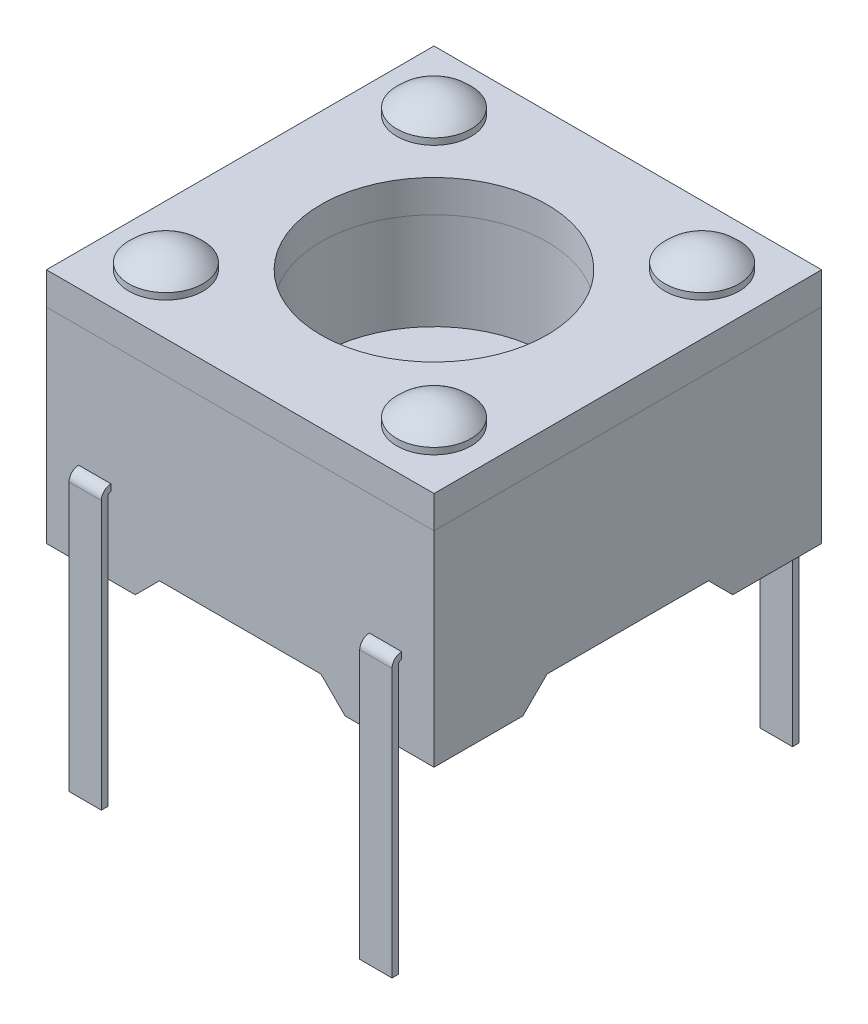
from build123d import *

# Parameters (mm, degrees)
SKETCH1_W                                = 6
SKETCH1_H                                = 6
BOSS_EXTRUDE1_DEPTH                      = 3.17
SKETCH2_W                                = 6
SKETCH2_H                                = 6
BOSS_EXTRUDE2_DEPTH                      = 0.5
SKETCH5_R                                = 1.75
CUT_EXTRUDE1_DEPTH                       = 2
EXTRUDE_THIN1_DEPTH                      = 0.5
MIRROR1_AT_THE_SECOND_PLANE_COPY_1_DEPTH = 0.5
CUT_EXTRUDE4_DEPTH                       = 8.879270271
CIRPATTERN1_COUNT                        = 2
CIRPATTERN1_ANGLE                        = 90


# Read off the part's stored shape, not the designer's step: Sketch-Pattern1
with BuildPart() as part:
    # Sketch1 → Boss-Extrude1 (new body)
    with BuildSketch(Plane(origin=(0, 0, 0), x_dir=(1, 0, 0), z_dir=(0, 1, 0))):
        Rectangle(SKETCH1_W, SKETCH1_H)
    extrude(amount=BOSS_EXTRUDE1_DEPTH)


with BuildPart() as body_2:
    # Sketch2 → Boss-Extrude2 (new body)
    with BuildSketch(Plane(origin=(0, 3.17, 0), x_dir=(1, 0, 0), z_dir=(0, 1, 0))):
        Rectangle(SKETCH2_W, SKETCH2_H)
    extrude(amount=BOSS_EXTRUDE2_DEPTH)

    # Sketch4 → Revolve1 (revolve)
    with BuildSketch(Plane.YZ.offset(2.075), mode=Mode.PRIVATE) as revolve1_sk:
        with BuildLine():
            Line((3.67, 2.65), (3.77, 2.65))
            ThreePointArc((3.77, 2.65), (3.954796332, 2.388498405), (4.02, 2.075))
            Line((4.02, 2.075), (3.67, 2.075))
            Line((3.67, 2.075), (3.17, 2.075))
            Line((3.17, 2.075), (3.17, 2.65))
            Line((3.17, 2.65), (3.67, 2.65))
        make_face()
    revolve(revolve1_sk.sketch.rotate(Axis((2.075, 3.67, 2.075), (0, 1, 0)), 180), axis=Axis((2.075, 3.67, 2.075), (0, 1, 0)))

    # Sketch-Pattern1 outline → Sketch-Pattern1 (revolve)
    with BuildSketch(Plane(origin=(-2.075, 0, 2.075), x_dir=(1, 0, 0), z_dir=(0, 0, 1))):
        with BuildLine():
            Line((0.575, 3.67), (0.575000001, 3.769999999))
            ThreePointArc((0.575000001, 3.769999999), (0.313498406, 3.954796332), (0, 4.02))
            Line((0, 4.02), (0, 3.67))
            Line((0, 3.67), (0.575, 3.67))
        make_face()
    revolve(axis=Axis((-2.075, 0, 2.075), (0, 1, 0)))

    # Sketch-Pattern1 2 outline → Sketch-Pattern1 2 (revolve)
    with BuildSketch(Plane(origin=(-2.075, 0, -2.075), x_dir=(1, 0, 0), z_dir=(0, 0, 1))):
        with BuildLine():
            Line((0.575, 3.67), (0.575000001, 3.769999999))
            ThreePointArc((0.575000001, 3.769999999), (0.313498406, 3.954796332), (0, 4.02))
            Line((0, 4.02), (0, 3.67))
            Line((0, 3.67), (0.575, 3.67))
        make_face()
    revolve(axis=Axis((-2.075, 0, -2.075), (0, 1, 0)))

    # Sketch-Pattern1 3 outline → Sketch-Pattern1 3 (revolve)
    with BuildSketch(Plane(origin=(2.075, 0, -2.075), x_dir=(1, 0, 0), z_dir=(0, 0, 1))):
        with BuildLine():
            Line((0.575, 3.67), (0.575000001, 3.769999999))
            ThreePointArc((0.575000001, 3.769999999), (0.313498406, 3.954796332), (0, 4.02))
            Line((0, 4.02), (0, 3.67))
            Line((0, 3.67), (0.575, 3.67))
        make_face()
    revolve(axis=Axis((2.075, 0, -2.075), (0, 1, 0)))


with BuildPart() as cut_extrude1_tool:
    # Sketch5 → Cut-Extrude1 (new body)
    with BuildSketch(Plane(origin=(0, 3.67, 0), x_dir=(1, 0, 0), z_dir=(0, 1, 0))):
        with Locations(Location((0, 0, 0), (0, 0, 270))):
            Circle(SKETCH5_R)
    extrude(amount=-CUT_EXTRUDE1_DEPTH)


with BuildPart() as part_1:
    add(part.part)

    # Cut-Extrude1: cut by cut_extrude1_tool
    add(cut_extrude1_tool.part, mode=Mode.SUBTRACT)

    # Sketch6 → Extrude-Thin1 (add)
    with BuildSketch(Plane.ZY.offset(2.5)):
        with BuildLine():
            ThreePointArc((3, 1.2), (3.035355348, 1.185355337), (3.05, 1.149999984))
            Line((3.05, 1.149999984), (3.05, -3))
            Line((3.05, -3), (3.15, -3))
            Line((3.15, -3), (3.15, 1.150000012))
            ThreePointArc((3.15, 1.150000012), (3.106066008, 1.256066033), (2.999999977, 1.3))
            Line((2.999999977, 1.3), (3, 1.2))
        make_face()
    extrude_thin1 = extrude(amount=-EXTRUDE_THIN1_DEPTH)

    # Mirror1: Extrude-Thin1 across plane
    add(extrude_thin1.mirror(Plane.XY))

    # Mirror1 at the second plane: Extrude-Thin1 across plane
    add(extrude_thin1.mirror(Plane(origin=(0, 0, 0), x_dir=(0, 0, 1), z_dir=(1, 0, 0))))

    # Mirror1 at the second plane copy 1 sketc → Mirror1 at the second plane copy 1 (add)
    with BuildSketch(Plane(origin=(2.5, 0, 0), x_dir=(0, 0, -1), z_dir=(1, 0, 0))):
        with BuildLine():
            ThreePointArc((3, 1.2), (3.035355348, 1.185355337), (3.05, 1.149999984))
            Line((3.05, 1.149999984), (3.05, -3))
            Line((3.05, -3), (3.15, -3))
            Line((3.15, -3), (3.15, 1.150000012))
            ThreePointArc((3.15, 1.150000012), (3.106066008, 1.256066033), (2.999999977, 1.3))
            Line((2.999999977, 1.3), (3, 1.2))
        make_face()
    extrude(amount=-MIRROR1_AT_THE_SECOND_PLANE_COPY_1_DEPTH)

    # Sketch7 → Cut-Extrude4 (cut, through all)
    with BuildSketch(Plane.ZY.offset(3)):
        Polygon((-1.625, 0), (-1.25, 0.375), (1.25, 0.375), (1.625, 0), align=None)
    cut_extrude4 = extrude(amount=-CUT_EXTRUDE4_DEPTH, mode=Mode.SUBTRACT)

    # CirPattern1: Cut-Extrude4 ×2 about axis
    cirpattern1_axis = Axis((0, 4.371, 0), (0, -1, 0))
    for i in range(1, CIRPATTERN1_COUNT):
        add(cut_extrude4.rotate(cirpattern1_axis, i * CIRPATTERN1_ANGLE / (CIRPATTERN1_COUNT - 1)), mode=Mode.SUBTRACT)


with BuildPart() as body_2_1:
    add(body_2.part)

    # Cut-Extrude1: cut by cut_extrude1_tool
    add(cut_extrude1_tool.part, mode=Mode.SUBTRACT)


solid = Compound([part_1.part, body_2_1.part])
